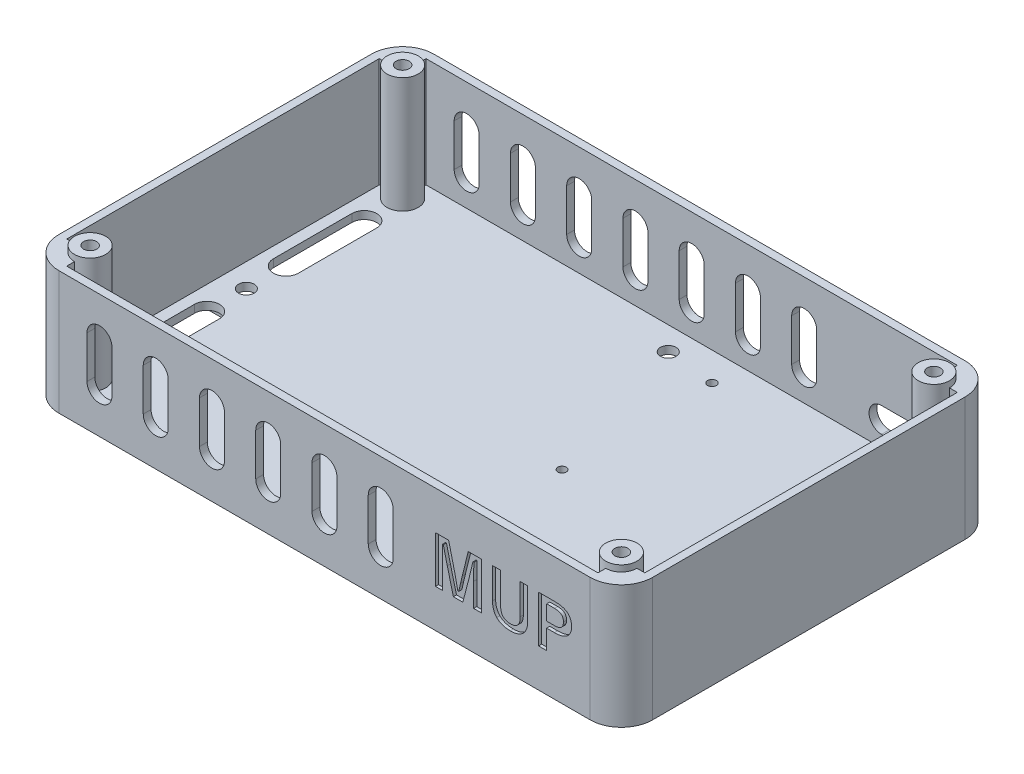
from build123d import *

# Parameters (mm, degrees)
SKETCH1_R                    = 5.5
BOSS_EXTRUDE1_DEPTH          = 2
BOSS_EXTRUDE2_DEPTH          = 2.5
BOSS_EXTRUDE4_DEPTH          = 35
F_5_0_5_DIAMETER_HOLE1_D     = 5
F_5_0_5_DIAMETER_HOLE1_DEPTH = 2.5
F_5_0_5_DIAMETER_HOLE1_TIP   = 1.502151548
SKETCH8_R                    = 5
BOSS_EXTRUDE5_DEPTH          = 2
TAP_DRILL_FOR_M5_TAP1_D      = 4.2
TAP_DRILL_FOR_M5_TAP1_DEPTH  = 20
TAP_DRILL_FOR_M5_TAP1_TIP    = 1.2618073
CUT_EXTRUDE2_DEPTH           = 2.5
SKETCH17_R                   = 1.35
SKETCH17_R_2                 = 1.404475062
CUT_EXTRUDE3_DEPTH           = 2.5
CUT_EXTRUDE5_DEPTH           = 2.5
CUT_EXTRUDE6_DEPTH           = 1
CUT_EXTRUDE7_DEPTH           = 2.5
CUT_EXTRUDE8_START           = -2.5
CUT_EXTRUDE8_DEPTH           = 2.5


with BuildPart() as part:
    # Sketch1 → Boss-Extrude1 (new body)
    with BuildSketch(Plane(origin=(0, 94.5, 0), x_dir=(1, 0, 0), z_dir=(0, 1, 0))):
        with BuildLine():
            ThreePointArc((94.824063881, -94.891398577), (91.895131693, -87.820330766), (84.824063881, -84.891398577))
            Line((84.824063881, -84.891398577), (-85.175936119, -84.891398577))
            ThreePointArc((-85.175936119, -84.891398577), (-92.247003931, -87.820330766), (-95.175936119, -94.891398577))
            Line((-95.175936119, -94.891398577), (-95.175936119, -194.891398577))
            ThreePointArc((-95.175936119, -194.891398577), (-92.247003931, -201.962466389), (-85.175936119, -204.891398577))
            Line((-85.175936119, -204.891398577), (84.824063881, -204.891398577))
            ThreePointArc((84.824063881, -204.891398577), (91.895131693, -201.962466389), (94.824063881, -194.891398577))
            Line((94.824063881, -194.891398577), (94.824063881, -94.891398577))
        make_face()
        with Locations((-0.175936119, -194.891398577)):
            Circle(SKETCH1_R, mode=Mode.SUBTRACT)
        with BuildLine():
            ThreePointArc((7.324063881, -194.891398577), (-0.175936119, -187.391398577), (-7.675936119, -194.891398577))
            Line((-7.675936119, -194.891398577), (-7.675936119, -202.391398577))
            Line((-7.675936119, -202.391398577), (-85.175936119, -202.391398577))
            ThreePointArc((-85.175936119, -202.391398577), (-90.479236978, -200.194699436), (-92.675936119, -194.891398577))
            Line((-92.675936119, -194.891398577), (-92.675936119, -152.391398577))
            Line((-92.675936119, -152.391398577), (-85.175936119, -152.391398577))
            ThreePointArc((-85.175936119, -152.391398577), (-77.699334308, -144.299431209), (-86.356177266, -137.484845342))
            Line((-86.356177266, -137.484845342), (-92.675936119, -137.484845342))
            Line((-92.675936119, -137.484845342), (-92.675936119, -94.891398577))
            ThreePointArc((-92.675936119, -94.891398577), (-90.479236978, -89.588097719), (-85.175936119, -87.391398577))
            Line((-85.175936119, -87.391398577), (-7.675936119, -87.391398577))
            Line((-7.675936119, -87.391398577), (-7.675936119, -94.189123751))
            Line((-7.675936119, -94.189123751), (-7.641500232, -94.173518038))
            ThreePointArc((-7.641500232, -94.173518038), (-0.535289114, -102.382784659), (7.324063881, -94.891398577))
            Line((7.324063881, -94.891398577), (7.324063881, -87.391398577))
            Line((7.324063881, -87.391398577), (84.824063881, -87.391398577))
            ThreePointArc((84.824063881, -87.391398577), (90.12736474, -89.588097719), (92.324063881, -94.891398577))
            Line((92.324063881, -94.891398577), (92.324063881, -137.391398577))
            Line((92.324063881, -137.391398577), (84.824063881, -137.391398577))
            ThreePointArc((84.824063881, -137.391398577), (77.324063881, -144.891398577), (84.824063881, -152.391398577))
            Line((84.824063881, -152.391398577), (92.324063881, -152.391398577))
            Line((92.324063881, -152.391398577), (92.324063881, -194.891398577))
            ThreePointArc((92.324063881, -194.891398577), (90.12736474, -200.194699436), (84.824063881, -202.391398577))
            Line((84.824063881, -202.391398577), (7.324063881, -202.391398577))
            Line((7.324063881, -202.391398577), (7.324063881, -194.891398577))
        make_face(mode=Mode.SUBTRACT)
        with Locations((84.824063881, -144.891398577)):
            Circle(SKETCH1_R, mode=Mode.SUBTRACT)
        with Locations((-0.175936119, -94.891398577)):
            Circle(SKETCH1_R, mode=Mode.SUBTRACT)
        with Locations((-85.175936119, -144.891398577)):
            Circle(SKETCH1_R, mode=Mode.SUBTRACT)
    extrude(amount=BOSS_EXTRUDE1_DEPTH)

    # Sketch2 → Boss-Extrude2 (add)
    with BuildSketch(Plane(origin=(0, 96.5, 0), x_dir=(1, 0, 0), z_dir=(0, 1, 0))):
        with BuildLine():
            Line((84.824063881, -84.891398577), (-85.175936119, -84.891398577))
            ThreePointArc((-85.175936119, -84.891398577), (-92.247003931, -87.820330766), (-95.175936119, -94.891398577))
            Line((-95.175936119, -94.891398577), (-95.175936119, -194.891398577))
            ThreePointArc((-95.175936119, -194.891398577), (-92.247003931, -201.962466389), (-85.175936119, -204.891398577))
            Line((-85.175936119, -204.891398577), (84.824063881, -204.891398577))
            ThreePointArc((84.824063881, -204.891398577), (91.895131693, -201.962466389), (94.824063881, -194.891398577))
            Line((94.824063881, -194.891398577), (94.824063881, -94.891398577))
            ThreePointArc((94.824063881, -94.891398577), (91.895131693, -87.820330766), (84.824063881, -84.891398577))
        make_face()
    extrude(amount=BOSS_EXTRUDE2_DEPTH)

    # Sketch5 → Boss-Extrude4 (add)
    with BuildSketch(Plane(origin=(0, 99, 0), x_dir=(1, 0, 0), z_dir=(0, 1, 0))):
        with BuildLine():
            Line((-95.175936119, -94.891398577), (-95.175936119, -194.891398577))
            ThreePointArc((-95.175936119, -194.891398577), (-92.247003931, -201.962466389), (-85.175936119, -204.891398577))
            Line((-85.175936119, -204.891398577), (84.824063881, -204.891398577))
            ThreePointArc((84.824063881, -204.891398577), (91.895131693, -201.962466389), (94.824063881, -194.891398577))
            Line((94.824063881, -194.891398577), (94.824063881, -94.891398577))
            ThreePointArc((94.824063881, -94.891398577), (91.895131693, -87.820330766), (84.824063881, -84.891398577))
            Line((84.824063881, -84.891398577), (-85.175936119, -84.891398577))
            ThreePointArc((-85.175936119, -84.891398577), (-92.247003931, -87.820330766), (-95.175936119, -94.891398577))
        make_face()
        with BuildLine():
            Line((92.324063881, -94.891398577), (92.324063881, -194.891398577))
            Line((92.324063881, -194.891398577), (89.824063881, -194.891398577))
            ThreePointArc((89.824063881, -194.891398577), (81.288529975, -191.355864672), (84.824063881, -199.891398577))
            Line((84.824063881, -199.891398577), (84.824063881, -202.391398577))
            Line((84.824063881, -202.391398577), (-85.175936119, -202.391398577))
            Line((-85.175936119, -202.391398577), (-85.175936119, -199.891398577))
            ThreePointArc((-85.175936119, -199.891398577), (-81.640402213, -191.355864672), (-90.175936119, -194.891398577))
            Line((-90.175936119, -194.891398577), (-92.675936119, -194.891398577))
            Line((-92.675936119, -194.891398577), (-92.675936119, -94.891398577))
            Line((-92.675936119, -94.891398577), (-90.175936119, -94.891398577))
            ThreePointArc((-90.175936119, -94.891398577), (-81.640402213, -98.426932483), (-85.175936119, -89.891398577))
            Line((-85.175936119, -89.891398577), (-85.175936119, -87.391398577))
            Line((-85.175936119, -87.391398577), (84.824063881, -87.391398577))
            Line((84.824063881, -87.391398577), (84.824063881, -89.891398577))
            ThreePointArc((84.824063881, -89.891398577), (81.288529975, -98.426932483), (89.824063881, -94.891398577))
            Line((89.824063881, -94.891398577), (92.324063881, -94.891398577))
        make_face(mode=Mode.SUBTRACT)
    extrude(amount=BOSS_EXTRUDE4_DEPTH)

    # Ø5.0 (5) Diameter Hole1
    with Locations(Plane(origin=(0, 99, 0), x_dir=(1, 0, 0), z_dir=(0, 1, 0))):
        with Locations((-0.175936119, -94.891398577), (-85.175936119, -144.891398577), (84.824063881, -144.891398577), (-0.175936119, -194.891398577)):
            Hole(F_5_0_5_DIAMETER_HOLE1_D / 2, depth=F_5_0_5_DIAMETER_HOLE1_DEPTH)
            with Locations((0, 0, -(F_5_0_5_DIAMETER_HOLE1_DEPTH + F_5_0_5_DIAMETER_HOLE1_TIP / 2))):  # 118° drill point
                Cone(0, F_5_0_5_DIAMETER_HOLE1_D / 2, F_5_0_5_DIAMETER_HOLE1_TIP, mode=Mode.SUBTRACT)

    # Sketch8 → Boss-Extrude5 (add)
    with BuildSketch(Plane(origin=(0, 134, 0), x_dir=(1, 0, 0), z_dir=(0, 1, 0))):
        with Locations((-85.175936119, -194.891398577)):
            Circle(SKETCH8_R)
        with Locations((-85.175936119, -94.891398577)):
            Circle(SKETCH8_R)
        with Locations((84.824063881, -94.891398577)):
            Circle(SKETCH8_R)
        with Locations((84.824063881, -194.891398577)):
            Circle(SKETCH8_R)
    extrude(amount=BOSS_EXTRUDE5_DEPTH)

    # Tap Drill for M5 Tap1
    with Locations(Plane(origin=(0, 136, 0), x_dir=(1, 0, 0), z_dir=(0, 1, 0))):
        with Locations((-85.175936119, -94.891398577), (-85.175936119, -194.891398577), (84.824063881, -94.891398577), (84.824063881, -194.891398577)):
            Hole(TAP_DRILL_FOR_M5_TAP1_D / 2, depth=TAP_DRILL_FOR_M5_TAP1_DEPTH)
            with Locations((0, 0, -(TAP_DRILL_FOR_M5_TAP1_DEPTH + TAP_DRILL_FOR_M5_TAP1_TIP / 2))):  # 118° drill point
                Cone(0, TAP_DRILL_FOR_M5_TAP1_D / 2, TAP_DRILL_FOR_M5_TAP1_TIP, mode=Mode.SUBTRACT)

    # Sketch11 → Cut-Extrude2 (cut)
    with BuildSketch(Plane(origin=(0, 99, 0), x_dir=(1, 0, 0), z_dir=(0, 1, 0))):
        with BuildLine():
            Line((-81.140754753, -132.2652504), (-81.140754753, -107.2017198))
            ThreePointArc((-81.140754753, -107.2017198), (-85.140754753, -103.2017198), (-89.140754753, -107.2017198))
            Line((-89.140754753, -107.2017198), (-89.140754753, -132.2652504))
            ThreePointArc((-89.140754753, -132.2652504), (-85.140754753, -136.2652504), (-81.140754753, -132.2652504))
        make_face()
        with BuildLine():
            Line((-89.140754753, -182.581077355), (-89.140754753, -157.517546755))
            ThreePointArc((-89.140754753, -157.517546755), (-85.140754753, -153.517546755), (-81.140754753, -157.517546755))
            Line((-81.140754753, -157.517546755), (-81.140754753, -182.581077355))
            ThreePointArc((-81.140754753, -182.581077355), (-85.140754753, -186.581077355), (-89.140754753, -182.581077355))
        make_face()
    extrude(amount=-CUT_EXTRUDE2_DEPTH, mode=Mode.SUBTRACT)

    # Sketch17 → Cut-Extrude3 (cut)
    with BuildSketch(Plane(origin=(0, 99, 0), x_dir=(1, 0, 0), z_dir=(0, 1, 0))):
        with Locations((15.469678797, -144.526702453)):
            Circle(SKETCH17_R)
        with Locations((15.469678797, -96.526702453)):
            Circle(SKETCH17_R_2)
        with Locations((73.469678797, -144.526702453)):
            Circle(SKETCH17_R)
        with Locations((73.469678797, -96.526702453)):
            Circle(SKETCH17_R)
    extrude(amount=-CUT_EXTRUDE3_DEPTH, mode=Mode.SUBTRACT)

    # Sketch19 → Cut-Extrude5 (cut)
    with BuildSketch(Plane(origin=(0, 0, 84.891398577), x_dir=(-1, 0, 0), z_dir=(0, 0, -1))):
        with BuildLine():
            Line((-74.074063881, 110.75), (-60.574063881, 110.75))
            ThreePointArc((-60.574063881, 110.75), (-56.574063881, 106.75), (-60.574063881, 102.75))
            Line((-60.574063881, 102.75), (-74.074063881, 102.75))
            ThreePointArc((-74.074063881, 102.75), (-78.074063881, 106.75), (-74.074063881, 110.75))
        make_face()
    extrude(amount=-CUT_EXTRUDE5_DEPTH, mode=Mode.SUBTRACT)

    # Sketch20 → Cut-Extrude6 (cut)
    # profile 1 of 3: a face of its own
    with BuildSketch(Plane.XY.offset(204.891398577)):
        with BuildLine():
            Line((50.028199812, 121.649348958), (50.028199812, 106.75))
            Line((50.028199812, 106.75), (47.558832267, 106.75))
            Line((47.558832267, 106.75), (47.558832267, 114.282818168))
            add(Edge.make_bspline(
                [(47.558832267, 114.282818168), (47.558622189, 114.436172648), (47.558176719, 114.761360534), (47.561969644, 115.277769719), (47.564602833, 115.850537116), (47.566513533, 116.480592901), (47.573334484, 117.166975452), (47.577603646, 117.909744322), (47.587118856, 118.708828397), (47.592220604, 119.260352433), (47.594861199, 119.545813642)],
                knots=[0, 0, 0, 0, 0.699295905, 1.482855652, 2.354879395, 3.311154761, 4.355919964, 5.484935151, 6.69823724, 8, 8, 8, 8], degree=3))
            Line((47.594861199, 119.545813642), (47.323258483, 119.545813642))
            add(Edge.make_bspline(
                [(47.323258483, 119.545813642), (47.264138539, 119.282525178), (47.149191245, 118.770611699), (46.981786845, 118.025412029), (46.815932553, 117.325916242), (46.663812199, 116.668806054), (46.508508869, 116.057686186), (46.369144521, 115.488580053), (46.23352567, 114.964681128), (46.142057687, 114.630999983), (46.098274808, 114.471277195)],
                knots=[0, 0, 0, 0, 1.240476229, 2.411866029, 3.510996527, 4.545200336, 5.512368195, 6.409496292, 7.238675333, 8, 8, 8, 8], degree=3))
            Line((46.098274808, 114.471277195), (44.088969005, 106.75))
            Line((44.088969005, 106.75), (41.065310204, 106.75))
            Line((41.065310204, 106.75), (39.111433527, 114.377047681))
            add(Edge.make_bspline(
                [(39.111433527, 114.377047681), (39.103129843, 114.410307825), (39.083971532, 114.487045824), (39.051335931, 114.616540832), (39.00759563, 114.774430579), (38.966418556, 114.964358955), (38.908204736, 115.182162416), (38.849493964, 115.431458306), (38.778295007, 115.708827512), (38.704934601, 116.017047703), (38.620402734, 116.354601157), (38.533574739, 116.722957499), (38.434122805, 117.120305212), (38.334803427, 117.549265756), (38.218091141, 118.005128957), (38.103174944, 118.492794295), (37.978669728, 119.009259232), (37.892084433, 119.363843482), (37.847649464, 119.545813642)],
                knots=[0, 0, 0, 0, 0.309238681, 0.713477303, 1.204658518, 1.786810999, 2.465926404, 3.238023104, 4.097019439, 5.049008806, 6.095981555, 7.235965016, 8.462828884, 9.790811529, 11.207651633, 12.707424911, 14.310273458, 16, 16, 16, 16], degree=3))
            Line((37.847649464, 119.545813642), (37.578818205, 119.545813642))
            add(Edge.make_bspline(
                [(37.578818205, 119.545813642), (37.594984434, 118.672829208), (37.627691388, 116.906637466), (37.632045398, 115.140147409), (37.63424733, 114.246789236)],
                knots=[0, 0, 0, 0, 0.988550013, 2, 2, 2, 2], degree=3))
            Line((37.63424733, 114.246789236), (37.63424733, 106.75))
            Line((37.63424733, 106.75), (35.350567356, 106.75))
            Line((35.350567356, 106.75), (35.350567356, 121.649348958))
            Line((35.350567356, 121.649348958), (39.552095076, 121.649348958))
            Line((39.552095076, 121.649348958), (41.422828064, 114.000129627))
            add(Edge.make_bspline(
                [(41.422828064, 114.000129627), (41.525393125, 113.577247296), (41.728218504, 112.740985239), (42.013093057, 111.494564029), (42.266563211, 110.268685864), (42.42155703, 109.456984581), (42.498153101, 109.055851625)],
                knots=[0, 0, 0, 0, 1.031833331, 2.040480294, 3.03162906, 4, 4, 4, 4], degree=3))
            Line((42.498153101, 109.055851625), (42.769755816, 109.055851625))
            add(Edge.make_bspline(
                [(42.769755816, 109.055851625), (42.784685806, 109.114939581), (42.818224688, 109.247675376), (42.869889711, 109.467791717), (42.930430883, 109.729548406), (43.004288077, 110.030788265), (43.079650818, 110.375393241), (43.169769938, 110.760085245), (43.266286241, 111.187002688), (43.333323734, 111.48548647), (43.368390373, 111.641620333)],
                knots=[0, 0, 0, 0, 0.551068972, 1.237927009, 2.044362201, 2.980423873, 4.042320384, 5.233810277, 6.553033984, 8, 8, 8, 8], degree=3))
            add(Edge.make_bspline(
                [(43.368390373, 111.641620333), (43.418809602, 111.865274455), (43.515353992, 112.293534689), (43.65943155, 112.903988638), (43.792208972, 113.453737293), (43.879019923, 113.798797007), (43.919910172, 113.961329239)],
                knots=[0, 0, 0, 0, 1.153804436, 2.209342502, 3.156553064, 4, 4, 4, 4], degree=3))
            Line((43.919910172, 113.961329239), (45.818357724, 121.649348958))
            Line((45.818357724, 121.649348958), (50.028199812, 121.649348958))
        make_face()
    # profile 2 of 3: a face of its own
    with BuildSketch(Plane.XY.offset(204.891398577)):
        with BuildLine():
            Line((64.863805276, 121.649348958), (64.863805276, 111.843936642))
            add(Edge.make_bspline(
                [(64.863805276, 111.843936642), (64.858661925, 111.615491623), (64.848674607, 111.171898879), (64.766412552, 110.528152853), (64.636494443, 109.927326624), (64.446897332, 109.370191371), (64.202175536, 108.858091575), (63.905811374, 108.387656708), (63.557492051, 107.957650881), (63.281291345, 107.714502107), (63.142730926, 107.592522709)],
                knots=[0, 0, 0, 0, 1.155203694, 2.243165468, 3.277180102, 4.259922972, 5.213054084, 6.141345898, 7.067576999, 8, 8, 8, 8], degree=3))
            add(Edge.make_bspline(
                [(63.142730926, 107.592522709), (63.01901123, 107.496475736), (62.76953855, 107.302803295), (62.356544394, 107.060302162), (61.91398425, 106.855745386), (61.441789738, 106.684040759), (60.937123051, 106.556792891), (60.402876145, 106.461787774), (59.837548686, 106.406460064), (59.450348409, 106.399054647), (59.25160631, 106.395253596)],
                knots=[0, 0, 0, 0, 0.904265754, 1.823392779, 2.759552219, 3.718639323, 4.722025448, 5.762865249, 6.85172382, 8, 8, 8, 8], degree=3))
            add(Edge.make_bspline(
                [(59.25160631, 106.395253596), (59.022281136, 106.399900105), (58.576306618, 106.40893629), (57.928613188, 106.482908112), (57.321321368, 106.597745029), (56.758612918, 106.773315058), (56.233917415, 106.98629137), (55.75505671, 107.255016959), (55.315301432, 107.568816667), (55.059163973, 107.817300611), (54.93090597, 107.9417262)],
                knots=[0, 0, 0, 0, 1.166146637, 2.267835116, 3.311979242, 4.304904815, 5.261355704, 6.186973198, 7.092146861, 8, 8, 8, 8], degree=3))
            add(Edge.make_bspline(
                [(54.93090597, 107.9417262), (54.822733326, 108.06228269), (54.606139791, 108.303672334), (54.331187601, 108.709838168), (54.100800917, 109.150335733), (53.912939193, 109.624663378), (53.762067339, 110.130553745), (53.65770455, 110.671702973), (53.597416904, 111.246696748), (53.588533867, 111.641475248), (53.583978219, 111.843936642)],
                knots=[0, 0, 0, 0, 0.917634974, 1.837375834, 2.772312225, 3.731458423, 4.725945822, 5.761527054, 6.852003457, 8, 8, 8, 8], degree=3))
            Line((53.583978219, 111.843936642), (53.583978219, 121.649348958))
            Line((53.583978219, 121.649348958), (56.164204015, 121.649348958))
            Line((56.164204015, 121.649348958), (56.164204015, 111.871651204))
            add(Edge.make_bspline(
                [(56.164204015, 111.871651204), (56.165618507, 111.730189827), (56.168360907, 111.455926171), (56.209848002, 111.058077369), (56.26799341, 110.686972843), (56.354479874, 110.342895604), (56.464535766, 110.027339361), (56.597925529, 109.737292767), (56.758995, 109.475820496), (56.945806208, 109.242023884), (57.154968222, 109.034013584), (57.390879586, 108.856236202), (57.648980942, 108.70172102), (57.935424813, 108.581452303), (58.242877378, 108.482911735), (58.576961275, 108.418743164), (58.93360825, 108.375709153), (59.18033482, 108.370966133), (59.307035436, 108.368530467)],
                knots=[0, 0, 0, 0, 1.258028535, 2.439050939, 3.555223008, 4.597849401, 5.590891407, 6.524928811, 7.432813323, 8.315990141, 9.182017763, 10.050032448, 10.938129722, 11.851208549, 12.807865492, 13.805692453, 14.873165063, 16, 16, 16, 16], degree=3))
            add(Edge.make_bspline(
                [(59.307035436, 108.368530467), (59.433735937, 108.370966244), (59.680462283, 108.37570948), (60.037110833, 108.418741969), (60.371189261, 108.482915827), (60.678660881, 108.581437974), (60.96503793, 108.701771289), (61.223377961, 108.856055739), (61.458949632, 109.035070052), (61.67132965, 109.240107223), (61.854616053, 109.476944809), (62.016358403, 109.737115129), (62.149473367, 110.027390835), (62.259608868, 110.342880705), (62.346072203, 110.686977228), (62.404224402, 111.058076091), (62.445709543, 111.455926523), (62.448452221, 111.730189947), (62.449866857, 111.871651204)],
                knots=[0, 0, 0, 0, 1.126780836, 2.194202194, 3.191981247, 4.14859226, 5.061627248, 5.949681883, 6.817654893, 7.689510776, 8.56754354, 9.475384464, 10.409377022, 11.40237135, 12.444947685, 13.561066165, 14.742031865, 16, 16, 16, 16], degree=3))
            Line((62.449866857, 111.871651204), (62.449866857, 121.649348958))
            Line((62.449866857, 121.649348958), (64.863805276, 121.649348958))
        make_face()
    # profile 3 of 3: a face of its own
    with BuildSketch(Plane.XY.offset(204.891398577)):
        with BuildLine():
            Line((68.341982907, 121.649348958), (73.5911211, 121.649348958))
            add(Edge.make_bspline(
                [(73.5911211, 121.649348958), (73.805559213, 121.646434018), (74.220271665, 121.640796672), (74.821846822, 121.589690609), (75.382775416, 121.509464131), (75.902121074, 121.389347429), (76.381342466, 121.241139704), (76.820056253, 121.059133886), (77.214754768, 120.838672842), (77.571581218, 120.589069432), (77.883911344, 120.301337696), (78.154037378, 119.98051769), (78.384865653, 119.627649765), (78.569217569, 119.238889995), (78.71826521, 118.818726462), (78.817345816, 118.363282668), (78.88433595, 117.876619382), (78.89000144, 117.54044696), (78.892916963, 117.367449007)],
                knots=[0, 0, 0, 0, 1.320629909, 2.554031376, 3.716113473, 4.808001367, 5.833865001, 6.803000249, 7.727679346, 8.613438602, 9.479306404, 10.335414512, 11.19087937, 12.068946363, 12.979598988, 13.930741538, 14.935137279, 16, 16, 16, 16], degree=3))
            add(Edge.make_bspline(
                [(78.892916963, 117.367449007), (78.888462833, 117.187017398), (78.879787915, 116.835606602), (78.802888877, 116.326659512), (78.682312476, 115.850922318), (78.509446822, 115.408015979), (78.284107198, 114.999445307), (78.010122494, 114.625394743), (77.688182399, 114.283550533), (77.439751456, 114.090278703), (77.313186883, 113.991815258)],
                knots=[0, 0, 0, 0, 1.115735908, 2.173020832, 3.176697313, 4.146807987, 5.106116177, 6.054980975, 7.009098879, 8, 8, 8, 8], degree=3))
            add(Edge.make_bspline(
                [(77.313186883, 113.991815258), (77.191910202, 113.909730187), (76.944950356, 113.742577554), (76.538277308, 113.537753956), (76.100902219, 113.361708415), (75.630024263, 113.221695145), (75.126997285, 113.111308878), (74.590976816, 113.031211406), (74.021534328, 112.98439187), (73.630933528, 112.977982), (73.430376636, 112.974690804)],
                knots=[0, 0, 0, 0, 0.861045499, 1.75337634, 2.67306046, 3.632752096, 4.640500096, 5.701522451, 6.819829568, 8, 8, 8, 8], degree=3))
            Line((73.430376636, 112.974690804), (70.924980159, 112.974690804))
            Line((70.924980159, 112.974690804), (70.924980159, 106.75))
            Line((70.924980159, 106.75), (68.341982907, 106.75))
            Line((68.341982907, 106.75), (68.341982907, 121.649348958))
        make_face()
        with BuildLine():
            Line((70.924980159, 119.714872475), (70.924980159, 114.909167287))
            Line((70.924980159, 114.909167287), (73.355547316, 114.909167287))
            add(Edge.make_bspline(
                [(73.355547316, 114.909167287), (73.47388198, 114.910122262), (73.703589929, 114.911976034), (74.03567506, 114.944479475), (74.345297116, 114.989895622), (74.631850724, 115.056251751), (74.896440047, 115.141813807), (75.139120945, 115.247007064), (75.358303999, 115.371688183), (75.556062028, 115.514033857), (75.727841965, 115.677847624), (75.876126696, 115.861301012), (76.006172977, 116.061329843), (76.106438624, 116.284703666), (76.189013063, 116.524569892), (76.241172455, 116.783768157), (76.280376199, 117.06048245), (76.283407852, 117.251814189), (76.284976604, 117.350820269)],
                knots=[0, 0, 0, 0, 1.300814759, 2.525105315, 3.665995331, 4.740489915, 5.755760999, 6.720302507, 7.644008874, 8.523934203, 9.393475176, 10.245569002, 11.113624848, 12.009131461, 12.931216062, 13.897681952, 14.912139354, 16, 16, 16, 16], degree=3))
            add(Edge.make_bspline(
                [(76.284976604, 117.350820269), (76.282961299, 117.446075438), (76.279035058, 117.631652696), (76.245394927, 117.900736831), (76.190770098, 118.151649325), (76.112549627, 118.383957196), (76.013140985, 118.598379467), (75.890529829, 118.794224978), (75.744329425, 118.970327946), (75.577537637, 119.129347259), (75.387365177, 119.268713205), (75.174434585, 119.387676902), (74.941627647, 119.490076971), (74.686514227, 119.574038273), (74.408685983, 119.635885553), (74.108893112, 119.683324354), (73.786571229, 119.711032049), (73.564384249, 119.713565621), (73.44977683, 119.714872475)],
                knots=[0, 0, 0, 0, 1.081844181, 2.10766175, 3.075292602, 3.994646757, 4.886758323, 5.754521608, 6.611876847, 7.480464852, 8.366318952, 9.282792992, 10.246145426, 11.251791674, 12.328737375, 13.47620041, 14.69818583, 16, 16, 16, 16], degree=3))
            Line((73.44977683, 119.714872475), (70.924980159, 119.714872475))
        make_face(mode=Mode.SUBTRACT)
    extrude(amount=-CUT_EXTRUDE6_DEPTH, mode=Mode.SUBTRACT)

    # Sketch21 → Cut-Extrude7 (cut)
    with BuildSketch(Plane.XY.offset(204.891398577)):
        with BuildLine():
            Line((-68.175936119, 121.260015684), (-68.175936119, 107.760015684))
            ThreePointArc((-68.175936119, 107.760015684), (-72.175936119, 103.760015684), (-76.175936119, 107.760015684))
            Line((-76.175936119, 107.760015684), (-76.175936119, 121.260015684))
            ThreePointArc((-76.175936119, 121.260015684), (-72.175936119, 125.260015684), (-68.175936119, 121.260015684))
        make_face()
        with BuildLine():
            Line((-58.175936119, 121.260015684), (-58.175936119, 107.760015684))
            ThreePointArc((-58.175936119, 107.760015684), (-54.175936119, 103.760015684), (-50.175936119, 107.760015684))
            Line((-50.175936119, 107.760015684), (-50.175936119, 121.260015684))
            ThreePointArc((-50.175936119, 121.260015684), (-54.175936119, 125.260015684), (-58.175936119, 121.260015684))
        make_face()
        with BuildLine():
            Line((-40.175936119, 121.260015684), (-40.175936119, 107.760015684))
            ThreePointArc((-40.175936119, 107.760015684), (-36.175936119, 103.760015684), (-32.175936119, 107.760015684))
            Line((-32.175936119, 107.760015684), (-32.175936119, 121.260015684))
            ThreePointArc((-32.175936119, 121.260015684), (-36.175936119, 125.260015684), (-40.175936119, 121.260015684))
        make_face()
        with BuildLine():
            Line((-22.175936119, 121.260015684), (-22.175936119, 107.760015684))
            ThreePointArc((-22.175936119, 107.760015684), (-18.175936119, 103.760015684), (-14.175936119, 107.760015684))
            Line((-14.175936119, 107.760015684), (-14.175936119, 121.260015684))
            ThreePointArc((-14.175936119, 121.260015684), (-18.175936119, 125.260015684), (-22.175936119, 121.260015684))
        make_face()
        with BuildLine():
            Line((-4.175936119, 121.260015684), (-4.175936119, 107.760015684))
            ThreePointArc((-4.175936119, 107.760015684), (-0.175936119, 103.760015684), (3.824063881, 107.760015684))
            Line((3.824063881, 107.760015684), (3.824063881, 121.260015684))
            ThreePointArc((3.824063881, 121.260015684), (-0.175936119, 125.260015684), (-4.175936119, 121.260015684))
        make_face()
        with BuildLine():
            Line((13.824063881, 121.260015684), (13.824063881, 107.760015684))
            ThreePointArc((13.824063881, 107.760015684), (17.824063881, 103.760015684), (21.824063881, 107.760015684))
            Line((21.824063881, 107.760015684), (21.824063881, 121.260015684))
            ThreePointArc((21.824063881, 121.260015684), (17.824063881, 125.260015684), (13.824063881, 121.260015684))
        make_face()
    extrude(amount=-CUT_EXTRUDE7_DEPTH, mode=Mode.SUBTRACT)

    # Sketch24 → Cut-Extrude8 (cut)
    with BuildSketch(Plane(origin=(0, 0, 84.891398577), x_dir=(-1, 0, 0), z_dir=(0, 0, -1)).offset(CUT_EXTRUDE8_START)):
        with BuildLine():
            Line((76.175936119, 121.260015684), (76.175936119, 107.760015684))
            ThreePointArc((76.175936119, 107.760015684), (72.175936119, 103.760015684), (68.175936119, 107.760015684))
            Line((68.175936119, 107.760015684), (68.175936119, 121.260015684))
            ThreePointArc((68.175936119, 121.260015684), (72.175936119, 125.260015684), (76.175936119, 121.260015684))
        make_face()
        with BuildLine():
            Line((58.175936119, 121.260015684), (58.175936119, 107.760015684))
            ThreePointArc((58.175936119, 107.760015684), (54.175936119, 103.760015684), (50.175936119, 107.760015684))
            Line((50.175936119, 107.760015684), (50.175936119, 121.260015684))
            ThreePointArc((50.175936119, 121.260015684), (54.175936119, 125.260015684), (58.175936119, 121.260015684))
        make_face()
        with BuildLine():
            Line((40.175936119, 121.260015684), (40.175936119, 107.760015684))
            ThreePointArc((40.175936119, 107.760015684), (36.175936119, 103.760015684), (32.175936119, 107.760015684))
            Line((32.175936119, 107.760015684), (32.175936119, 121.260015684))
            ThreePointArc((32.175936119, 121.260015684), (36.175936119, 125.260015684), (40.175936119, 121.260015684))
        make_face()
        with BuildLine():
            Line((22.175936119, 121.260015684), (22.175936119, 107.760015684))
            ThreePointArc((22.175936119, 107.760015684), (18.175936119, 103.760015684), (14.175936119, 107.760015684))
            Line((14.175936119, 107.760015684), (14.175936119, 121.260015684))
            ThreePointArc((14.175936119, 121.260015684), (18.175936119, 125.260015684), (22.175936119, 121.260015684))
        make_face()
        with BuildLine():
            Line((4.175936119, 121.260015684), (4.175936119, 107.760015684))
            ThreePointArc((4.175936119, 107.760015684), (0.175936119, 103.760015684), (-3.824063881, 107.760015684))
            Line((-3.824063881, 107.760015684), (-3.824063881, 121.260015684))
            ThreePointArc((-3.824063881, 121.260015684), (0.175936119, 125.260015684), (4.175936119, 121.260015684))
        make_face()
        with BuildLine():
            Line((-13.824063881, 121.260015684), (-13.824063881, 107.760015684))
            ThreePointArc((-13.824063881, 107.760015684), (-17.824063881, 103.760015684), (-21.824063881, 107.760015684))
            Line((-21.824063881, 107.760015684), (-21.824063881, 121.260015684))
            ThreePointArc((-21.824063881, 121.260015684), (-17.824063881, 125.260015684), (-13.824063881, 121.260015684))
        make_face()
        with BuildLine():
            Line((-31.824063881, 121.260015684), (-31.824063881, 107.760015684))
            ThreePointArc((-31.824063881, 107.760015684), (-35.824063881, 103.760015684), (-39.824063881, 107.760015684))
            Line((-39.824063881, 107.760015684), (-39.824063881, 121.260015684))
            ThreePointArc((-39.824063881, 121.260015684), (-35.824063881, 125.260015684), (-31.824063881, 121.260015684))
        make_face()
    extrude(amount=CUT_EXTRUDE8_DEPTH, mode=Mode.SUBTRACT)


solid = part.part
